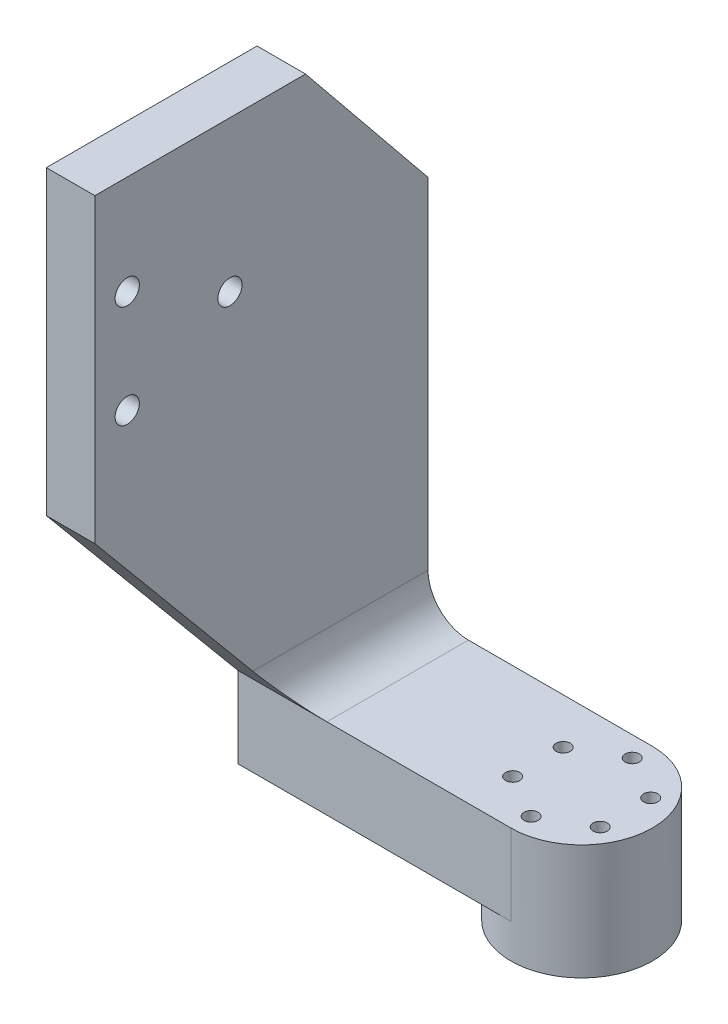
from build123d import *

# Parameters (mm, degrees)
BOSS_EXTRUDE1_DEPTH = 20
BOSS_EXTRUDE2_START = 8.5
SKETCH2_R           = 17.5
BOSS_EXTRUDE2_DEPTH = 8.5
BOSS_EXTRUDE3_DEPTH = 12
SKETCH4_R           = 3
CUT_EXTRUDE1_DEPTH  = 186.350058538
SKETCH5_R           = 1.75
CUT_EXTRUDE2_DEPTH  = 186.288354194
FILLET1_R           = 10


with BuildPart() as part:
    # Sketch1 → Boss-Extrude1 (new body)
    with BuildSketch(Plane(origin=(0, 0, 0), x_dir=(1, 0, 0), z_dir=(0, 1, 0))):
        with BuildLine():
            Line((67.5, 17.5), (0, 17.5))
            ThreePointArc((0, 17.5), (-17.5, 0), (0, -17.5))
            Line((0, -17.5), (67.5, -17.5))
            Line((67.5, -17.5), (67.5, 17.5))
        make_face()
    extrude(amount=BOSS_EXTRUDE1_DEPTH)

    # Sketch2 → Boss-Extrude2 (add)
    with BuildSketch(Plane.XZ.offset(BOSS_EXTRUDE2_START)):
        Circle(SKETCH2_R)
    extrude(amount=-BOSS_EXTRUDE2_DEPTH)

    # Sketch3 → Boss-Extrude3 (add)
    with BuildSketch(Plane(origin=(67.5, 0, 0), x_dir=(0, 0, -1), z_dir=(1, 0, 0))):
        Polygon((-17.5, 0), (17.5, 0), (17.5, 114.118307847), (-12.79, 151.39), (-64.89, 151.39), (-64.89, 76.846615693), (-57.39, 67.85), (-17.5, 20), align=None)
    extrude(amount=-BOSS_EXTRUDE3_DEPTH)

    # Sketch4 → Cut-Extrude1 (cut, through all)
    with BuildSketch(Plane(origin=(67.5, 0, 0), x_dir=(0, 0, -1), z_dir=(1, 0, 0))):
        with Locations((-56.89, 101.418307847)):
            Circle(SKETCH4_R)
        with Locations((-56.89, 126.818307847)):
            Circle(SKETCH4_R)
        with Locations((-31.49, 114.118307847)):
            Circle(SKETCH4_R)
    extrude(amount=-CUT_EXTRUDE1_DEPTH, mode=Mode.SUBTRACT)

    # Sketch5 → Cut-Extrude2 (cut, through all)
    with BuildSketch(Plane.XZ.offset(8.5)):
        with Locations((0, 12.5)):
            Circle(SKETCH5_R)
        with Locations((10.825317547, 6.25)):
            Circle(SKETCH5_R)
        with Locations((10.825317547, -6.25)):
            Circle(SKETCH5_R)
        with Locations((0, -12.5)):
            Circle(SKETCH5_R)
        with Locations((-10.825317547, -6.25)):
            Circle(SKETCH5_R)
        with Locations((-10.825317547, 6.25)):
            Circle(SKETCH5_R)
    extrude(amount=-CUT_EXTRUDE2_DEPTH, mode=Mode.SUBTRACT)

    # Fillet1
    fillet1_edges = [part.edges().sort_by_distance(p)[0] for p in [
        (55.5, 20, 0),
    ]]
    fillet(fillet1_edges, radius=FILLET1_R)


with BuildPart() as body_2:
    # Mirror1: mirrored copy
    add(part.part.mirror(Plane(origin=(-20, 0, 0), x_dir=(0, 0, 1), z_dir=(1, 0, 0))))


solid = body_2.part
